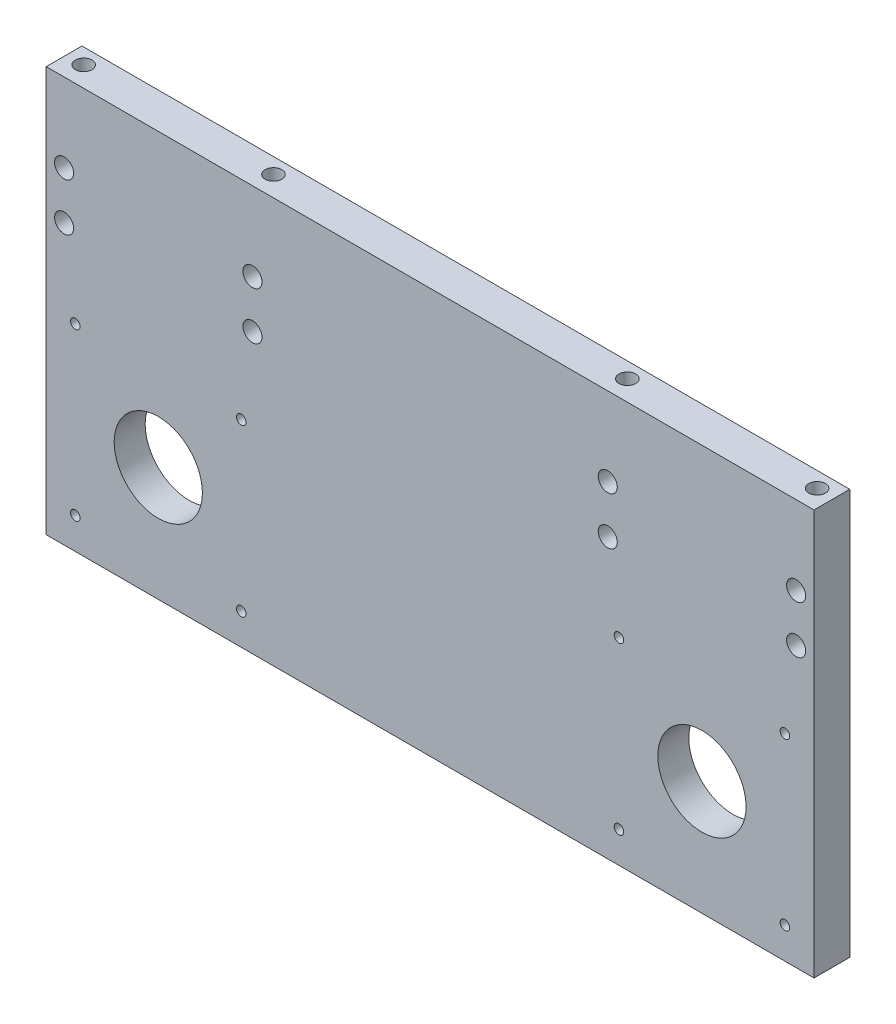
from build123d import *

# Parameters (mm, degrees)
SZKIC1_W                       = 322
SZKIC1_H                       = 170
DODANIE_WYCI_GNI_CIE1_DEPTH    = 15
SZKIC2_R                       = 2
WYTNIJ_WYCI_GNI_CIE2_DEPTH     = 17.75
SZYK_LINIOWY1_COUNT            = 2
SZYK_LINIOWY1_PITCH            = 69.6
SZYK_LINIOWY1_COUNT_DIR2       = 2
SZYK_LINIOWY1_PITCH_DIR2       = 69.6
SZKIC5_R                       = 37.5
WYTNIJ_WYCI_GNI_CIE3_DEPTH     = 2
SZKIC7_R                       = 18.5
WYTNIJ_WYCI_GNI_CIE4_DEPTH     = 17.75
SZKIC10_R                      = 4
WYTNIJ_WYCI_GNI_CIE7_DEPTH     = 183.677311125
SZYK_LINIOWY3_COUNT            = 2
SZYK_LINIOWY3_PITCH            = 79
SZYK_LINIOWY2_COUNT            = 2
SZYK_LINIOWY2_PITCH            = 228
SZYK_LINIOWY2_COPY_1_SKETCH_R  = 2
SZYK_LINIOWY2_COPY_1_DEPTH     = 17.75
SZYK_LINIOWY2_COPY_2_SKETCH_R  = 2
SZYK_LINIOWY2_COPY_2_DEPTH     = 17.75
SZYK_LINIOWY2_COPY_3_SKETCH_R  = 2
SZYK_LINIOWY2_COPY_3_DEPTH     = 17.75
SZYK_LINIOWY2_COPY_4_SKETCH_R  = 4
SZYK_LINIOWY2_COPY_4_DEPTH     = 183.677311125
SZYK_LINIOWY2_COPY_5_SKETCH_R  = 4
SZYK_LINIOWY2_COPY_5_DEPTH     = 183.677311125
OTW_R_GWINTOWANY_M8X1_01_D     = 7
OTW_R_GWINTOWANY_M8X1_01_DEPTH = 21
OTW_R_GWINTOWANY_M8X1_01_TIP   = 2.103012167


with BuildPart() as part:
    # Szkic1 → Dodanie-wyciągnięcie1 (new body)
    with BuildSketch(Plane.XY):
        Rectangle(SZKIC1_W, SZKIC1_H)
    extrude(amount=DODANIE_WYCI_GNI_CIE1_DEPTH)

    # Szkic2 → Wytnij-wyciągnięcie2 (cut)
    with BuildSketch(Plane.XY.offset(15)):
        with Locations((-148.8, -71.87)):
            Circle(SZKIC2_R)
    wytnij_wyci_gni_cie2 = extrude(amount=-WYTNIJ_WYCI_GNI_CIE2_DEPTH, mode=Mode.SUBTRACT)

    # Szyk liniowy1: Wytnij-wyci_gni_cie2 2 × 2
    with Locations(*[(i * SZYK_LINIOWY1_PITCH, j * SZYK_LINIOWY1_PITCH_DIR2, 0) for i in range(SZYK_LINIOWY1_COUNT) for j in range(SZYK_LINIOWY1_COUNT_DIR2) if (i, j) != (0, 0)]):
        add(wytnij_wyci_gni_cie2, mode=Mode.SUBTRACT)

    # Szkic5 → Wytnij-wyciągnięcie3 (cut)
    with BuildSketch(Plane(origin=(0, 0, 0), x_dir=(-1, 0, 0), z_dir=(0, 0, -1))):
        with Locations((114, -37.07)):
            Circle(SZKIC5_R)
    wytnij_wyci_gni_cie3 = extrude(amount=-WYTNIJ_WYCI_GNI_CIE3_DEPTH, mode=Mode.SUBTRACT)

    # Szkic7 → Wytnij-wyciągnięcie4 (cut)
    with BuildSketch(Plane(origin=(0, 0, 2), x_dir=(-1, 0, 0), z_dir=(0, 0, -1))):
        with Locations((114, -37.07)):
            Circle(SZKIC7_R)
    wytnij_wyci_gni_cie4 = extrude(amount=-WYTNIJ_WYCI_GNI_CIE4_DEPTH, mode=Mode.SUBTRACT)

    # Szkic10 → Wytnij-wyciągnięcie7 (cut, through all)
    with BuildSketch(Plane.XY.offset(15)):
        with Locations((-153.5, 52)):
            Circle(SZKIC10_R)
        with Locations((-153.5, 32)):
            Circle(SZKIC10_R)
    wytnij_wyci_gni_cie7 = extrude(amount=-WYTNIJ_WYCI_GNI_CIE7_DEPTH, mode=Mode.SUBTRACT)

    # Szyk liniowy3: Wytnij-wyciągnięcie7 ×2
    with Locations(*[(i * SZYK_LINIOWY3_PITCH, 0, 0) for i in range(1, SZYK_LINIOWY3_COUNT)]):
        add(wytnij_wyci_gni_cie7, mode=Mode.SUBTRACT)

    # Szyk liniowy2: Wytnij-wyciągnięcie2, Wytnij-wyciągnięcie3, Wytnij-wyciągnięcie4 ×2
    with Locations(*[(i * SZYK_LINIOWY2_PITCH, 0, 0) for i in range(1, SZYK_LINIOWY2_COUNT)]):
        add(wytnij_wyci_gni_cie2, mode=Mode.SUBTRACT)
        add(wytnij_wyci_gni_cie3, mode=Mode.SUBTRACT)
        add(wytnij_wyci_gni_cie4, mode=Mode.SUBTRACT)

    # Szyk liniowy2 copy 1 sketch → Szyk liniowy2 copy 1 (cut)
    with BuildSketch(Plane(origin=(228, 69.6, 15), x_dir=(1, 0, 0), z_dir=(0, 0, 1))):
        with Locations((-148.8, -71.87)):
            Circle(SZYK_LINIOWY2_COPY_1_SKETCH_R)
    extrude(amount=-SZYK_LINIOWY2_COPY_1_DEPTH, mode=Mode.SUBTRACT)

    # Szyk liniowy2 copy 2 sketch → Szyk liniowy2 copy 2 (cut)
    with BuildSketch(Plane(origin=(297.6, 0, 15), x_dir=(1, 0, 0), z_dir=(0, 0, 1))):
        with Locations((-148.8, -71.87)):
            Circle(SZYK_LINIOWY2_COPY_2_SKETCH_R)
    extrude(amount=-SZYK_LINIOWY2_COPY_2_DEPTH, mode=Mode.SUBTRACT)

    # Szyk liniowy2 copy 3 sketch → Szyk liniowy2 copy 3 (cut)
    with BuildSketch(Plane(origin=(297.6, 69.6, 15), x_dir=(1, 0, 0), z_dir=(0, 0, 1))):
        with Locations((-148.8, -71.87)):
            Circle(SZYK_LINIOWY2_COPY_3_SKETCH_R)
    extrude(amount=-SZYK_LINIOWY2_COPY_3_DEPTH, mode=Mode.SUBTRACT)

    # Szyk liniowy2 copy 4 sketch → Szyk liniowy2 copy 4 (cut, through all)
    with BuildSketch(Plane(origin=(307, 0, 15), x_dir=(1, 0, 0), z_dir=(0, 0, 1))):
        with Locations((-153.5, 52)):
            Circle(SZYK_LINIOWY2_COPY_4_SKETCH_R)
        with Locations((-153.5, 32)):
            Circle(SZYK_LINIOWY2_COPY_4_SKETCH_R)
    extrude(amount=-SZYK_LINIOWY2_COPY_4_DEPTH, mode=Mode.SUBTRACT)

    # Szyk liniowy2 copy 5 sketch → Szyk liniowy2 copy 5 (cut, through all)
    with BuildSketch(Plane(origin=(228, 0, 15), x_dir=(1, 0, 0), z_dir=(0, 0, 1))):
        with Locations((-153.5, 52)):
            Circle(SZYK_LINIOWY2_COPY_5_SKETCH_R)
        with Locations((-153.5, 32)):
            Circle(SZYK_LINIOWY2_COPY_5_SKETCH_R)
    extrude(amount=-SZYK_LINIOWY2_COPY_5_DEPTH, mode=Mode.SUBTRACT)

    # Otwór gwintowany M8x1.01
    with Locations(Plane(origin=(0, 85, 0), x_dir=(1, 0, 0), z_dir=(0, 1, 0))):
        with Locations((-153.8, -6.5), (-74.2, -6.5), (74.2, -6.5), (153.8, -6.5)):
            Hole(OTW_R_GWINTOWANY_M8X1_01_D / 2, depth=OTW_R_GWINTOWANY_M8X1_01_DEPTH)
            with Locations((0, 0, -(OTW_R_GWINTOWANY_M8X1_01_DEPTH + OTW_R_GWINTOWANY_M8X1_01_TIP / 2))):  # 118° drill point
                Cone(0, OTW_R_GWINTOWANY_M8X1_01_D / 2, OTW_R_GWINTOWANY_M8X1_01_TIP, mode=Mode.SUBTRACT)


solid = part.part
